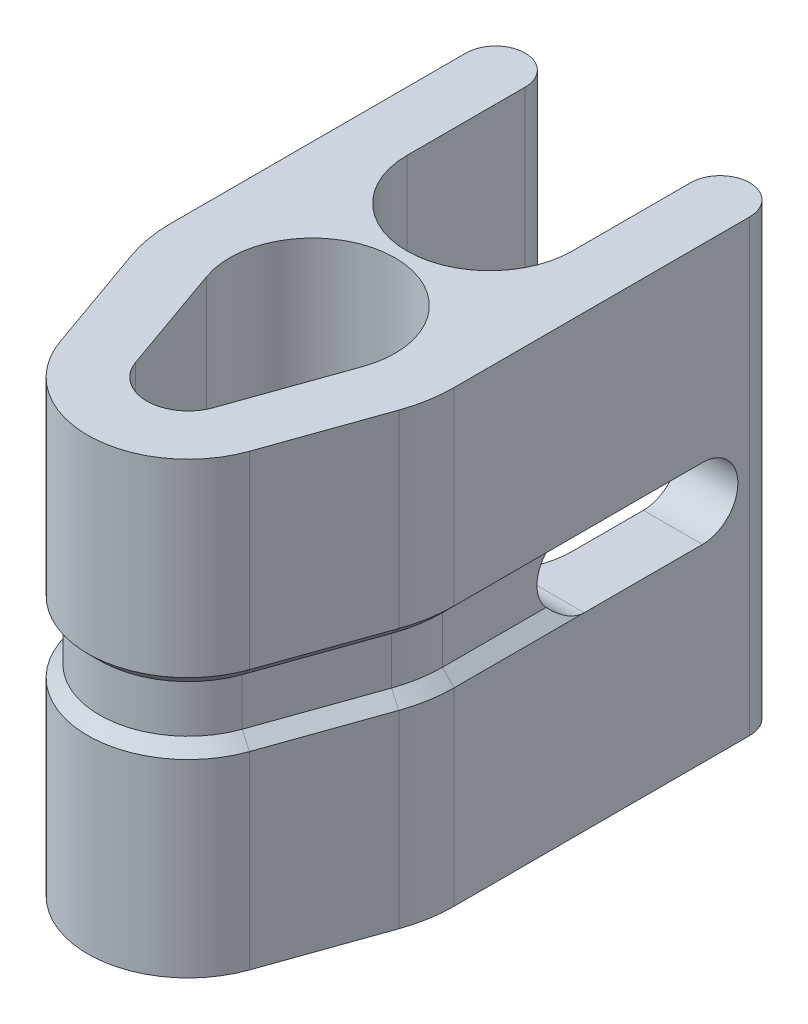
from build123d import *

# Parameters (mm, degrees)
BOSS_EXTRUDE1_DEPTH     = 35
BOSS_EXTRUDE2_START     = 3
BOSS_EXTRUDE2_DEPTH     = 3
CUT_EXTRUDE1_DEPTH      = 54.037722425
CUT_EXTRUDE1_DEPTH_BACK = 54.037722425
CUT_EXTRUDE2_START      = -3
CUT_EXTRUDE2_DEPTH      = 6
CHAMFER1_SIZE           = 1


with BuildPart() as part:
    # Sketch1 → Boss-Extrude1 (new body)
    with BuildSketch(Plane(origin=(0, 0, 0), x_dir=(1, 0, 0), z_dir=(0, 1, 0))):
        with BuildLine():
            Line((7, 25.5), (7, 35.5))
            ThreePointArc((7, 35.5), (9.5, 38), (12, 35.5))
            Line((12, 35.5), (12, 10.5))
            ThreePointArc((12, 10.5), (11.827182716, 8.470776255), (11.313708499, 6.5))
            Line((11.313708499, 6.5), (8.013876853, -2.833333333))
            ThreePointArc((8.013876853, -2.833333333), (0, -8.5), (-8.013876853, -2.833333333))
            Line((-8.013876853, -2.833333333), (-11.313708499, 6.5))
            ThreePointArc((-11.313708499, 6.5), (-11.827182716, 8.470776255), (-12, 10.5))
            Line((-12, 10.5), (-12, 35.5))
            ThreePointArc((-12, 35.5), (-9.5, 38), (-7, 35.5))
            Line((-7, 35.5), (-7, 25.5))
            ThreePointArc((-7, 25.5), (0, 18.5), (7, 25.5))
        make_face()
        with BuildLine():
            Line((-6.599663291, 8.166666667), (-3.299831646, -1.166666667))
            ThreePointArc((-3.299831646, -1.166666667), (0, -3.5), (3.299831646, -1.166666667))
            Line((3.299831646, -1.166666667), (6.599663291, 8.166666667))
            ThreePointArc((6.599663291, 8.166666667), (0, 17.5), (-6.599663291, 8.166666667))
        make_face(mode=Mode.SUBTRACT)
    extrude(amount=BOSS_EXTRUDE1_DEPTH)

    # Sketch2 → Boss-Extrude2 (add)
    with BuildSketch(Plane.XZ.offset(BOSS_EXTRUDE2_START)):
        with BuildLine():
            Line((-12, -10.5), (-12, -35.5))
            ThreePointArc((-12, -35.5), (-9.5, -38), (-7, -35.5))
            Line((-7, -35.5), (-7, -25.5))
            ThreePointArc((-7, -25.5), (0, -18.5), (7, -25.5))
            Line((7, -25.5), (7, -35.5))
            ThreePointArc((7, -35.5), (9.5, -38), (12, -35.5))
            Line((12, -35.5), (12, -10.5))
            ThreePointArc((12, -10.5), (11.827182716, -8.470776255), (11.313708499, -6.5))
            Line((11.313708499, -6.5), (8.013876853, 2.833333333))
            ThreePointArc((8.013876853, 2.833333333), (0, 8.5), (-8.013876853, 2.833333333))
            Line((-8.013876853, 2.833333333), (-11.313708499, -6.5))
            ThreePointArc((-11.313708499, -6.5), (-11.827182716, -8.470776255), (-12, -10.5))
        make_face()
    extrude(amount=-BOSS_EXTRUDE2_DEPTH)

    # Sketch4 → Cut-Extrude1 (cut, two sides: drawn at the far end of the back side and taken through both)
    with BuildSketch(Plane(origin=(0, 0, 0), x_dir=(0, 0, -1), z_dir=(1, 0, 0)).offset(-CUT_EXTRUDE1_DEPTH_BACK)):
        with BuildLine():
            Line((21.5, 19), (31.5, 19))
            ThreePointArc((31.5, 19), (34.5, 16), (31.5, 13))
            Line((31.5, 13), (21.5, 13))
            ThreePointArc((21.5, 13), (18.5, 16), (21.5, 19))
        make_face()
    extrude(amount=CUT_EXTRUDE1_DEPTH + CUT_EXTRUDE1_DEPTH_BACK, mode=Mode.SUBTRACT)

    # Sketch5 → Cut-Extrude2 (cut)
    with BuildSketch(Plane(origin=(0, 16, 0), x_dir=(1, 0, 0), z_dir=(0, 1, 0)).offset(CUT_EXTRUDE2_START)):
        with BuildLine():
            Line((-11, 21.5), (-25, 21.5))
            Line((-25, 21.5), (-25, -28.5))
            Line((-25, -28.5), (25, -28.5))
            Line((25, -28.5), (25, 21.5))
            Line((25, 21.5), (11, 21.5))
            Line((11, 21.5), (11, 10.5))
            ThreePointArc((11, 10.5), (10.841584156, 8.639878234), (10.370899457, 6.833333333))
            Line((10.370899457, 6.833333333), (7.071067812, -2.5))
            ThreePointArc((7.071067812, -2.5), (0, -7.5), (-7.071067812, -2.5))
            Line((-7.071067812, -2.5), (-10.370899457, 6.833333333))
            ThreePointArc((-10.370899457, 6.833333333), (-10.841584156, 8.639878234), (-11, 10.5))
            Line((-11, 10.5), (-11, 21.5))
        make_face()
    extrude(amount=CUT_EXTRUDE2_DEPTH, mode=Mode.SUBTRACT)

    # Chamfer1
    chamfer1_edges = [part.edges().sort_by_distance(p)[0] for p in [
        (11, 19, -16),
        (10.841584156, 19, -8.639878234),
        (0, 19, 7.5),
        (-10.841584156, 19, -8.639878234),
        (-11, 13, -16),
        (-8.720983635, 13, -2.166666667),
        (8.720983635, 13, -2.166666667),
        (11, 13, -16),
        (-11, 19, -16),
        (-8.720983635, 19, -2.166666667),
        (0, 13, 7.5),
        (8.720983635, 19, -2.166666667),
        (10.841584156, 13, -8.639878234),
        (-10.841584156, 13, -8.639878234),
    ]]
    chamfer(chamfer1_edges, length=CHAMFER1_SIZE - 0.0001)  # a hair under: the kernel refuses the full size


solid = part.part
